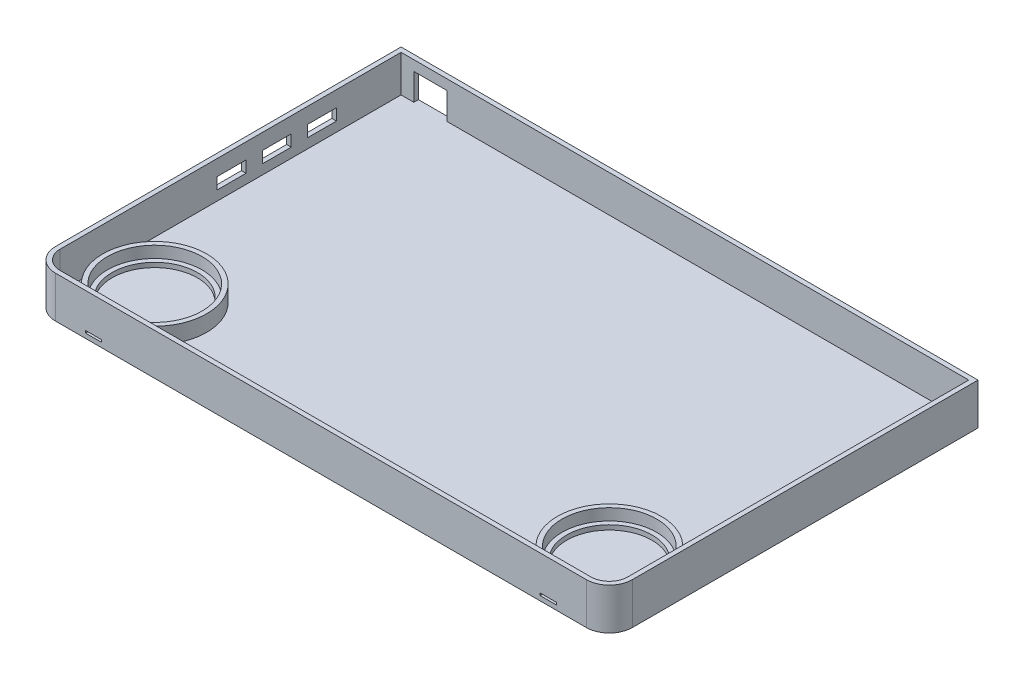
from build123d import *

# Parameters (mm, degrees)
EXTRUDE_2_DEPTH     = 18
SHELL_3_T           = -2
SKETCH_2_W          = 14.4
SKETCH_2_H          = 11.6
CUT_EXTRUDE_1_DEPTH = 10
SKETCH_3_W          = 12.5
SKETCH_3_H          = 5
CUT_EXTRUDE_2_DEPTH = 10
SKETCH_4_R          = 22.5
EXTRUDE_5_DEPTH     = 7
SHELL_START         = 2
SHELL_4_OUTLINE_R   = 20.5
SHELL_4_DEPTH       = 7
SKETCH_6_W          = 9
SKETCH_6_H          = 6.786647167
CUT_EXTRUDE_4_DEPTH = 14
SKETCH_9_W          = 2
SKETCH_9_H          = 3.464226151
SKETCH_9_H_2        = 3.181171453
SKETCH_9_H_3        = 3.477296157
EXTRUDE_6_DEPTH     = 7
EXTRUDE_8_DEPTH     = 2
SKETCH_11_W         = 7
SKETCH_11_H         = 1
CUT_EXTRUDE_5_DEPTH = 2


# Read off the part's stored shape, not the designer's step: 抽壳4
with BuildPart() as part:
    # 草图1 → 凸台-拉伸2 (new body)
    with BuildSketch(Plane(origin=(0, 0, 0), x_dir=(1, 0, 0), z_dir=(0, 1, 0))):
        with BuildLine():
            Line((-99.99792574, 53.871425224), (150.00207426, 53.871425224))
            Line((150.00207426, 53.871425224), (150.00207426, -95.878574776))
            ThreePointArc((150.00207426, -95.878574776), (147.073142072, -102.949642588), (140.00207426, -105.878574776))
            Line((140.00207426, -105.878574776), (-89.99792574, -105.878574776))
            ThreePointArc((-89.99792574, -105.878574776), (-97.068993552, -102.949642588), (-99.99792574, -95.878574776))
            Line((-99.99792574, -95.878574776), (-99.99792574, 53.871425224))
        make_face()
    extrude(amount=EXTRUDE_2_DEPTH)

    # 抽壳3
    shell_3_openings = [part.faces().sort_by_distance(p)[0] for p in [
        (25.00207426, 18, 25.920044782),
    ]]
    offset(amount=SHELL_3_T, openings=shell_3_openings, kind=Kind.INTERSECTION)

    # 草图2 → 切除-拉伸1 (cut)
    with BuildSketch(Plane.XY.offset(-51.871425224)):
        with Locations((-85.29792574, 7.8)):
            Rectangle(SKETCH_2_W, SKETCH_2_H)
    extrude(amount=-CUT_EXTRUDE_1_DEPTH, mode=Mode.SUBTRACT)

    # 草图3 → 切除-拉伸2 (cut)
    with BuildSketch(Plane(origin=(-97.99792574, 0, 0), x_dir=(0, 0, -1), z_dir=(1, 0, 0))):
        with Locations((17.621425224, 8.7)):
            Rectangle(SKETCH_3_W, SKETCH_3_H)
        with Locations((-1.978574776, 8.7)):
            Rectangle(SKETCH_3_W, SKETCH_3_H)
        with Locations((-21.578574776, 8.7)):
            Rectangle(SKETCH_3_W, SKETCH_3_H)
    extrude(amount=-CUT_EXTRUDE_2_DEPTH, mode=Mode.SUBTRACT)

    # 草图4 → 凸台-拉伸5 (add)
    with BuildSketch(Plane(origin=(0, 2, 0), x_dir=(1, 0, 0), z_dir=(0, 1, 0))):
        with Locations(Location((-73.49792574, -79.378574776, 0), (0, 0, 90))):
            Circle(SKETCH_4_R)
        with Locations(Location((123.50207426, -79.378574776, 0), (0, 0, 90))):
            Circle(SKETCH_4_R)
    extrude(amount=EXTRUDE_5_DEPTH)

    # 抽壳4 outline → 抽壳4 (cut)
    with BuildSketch(Plane(origin=(0, 0, 0), x_dir=(1, 0, 0), z_dir=(0, 1, 0)).offset(SHELL_START)):
        with Locations((123.50207426, -79.378574776)):
            Circle(SHELL_4_OUTLINE_R)
        with Locations((-73.49792574, -79.378574776)):
            Circle(SHELL_4_OUTLINE_R)
    extrude(amount=SHELL_4_DEPTH, mode=Mode.SUBTRACT)

    # 草图6 → 切除-拉伸4 (cut)
    with BuildSketch(Plane(origin=(0, 2, 0), x_dir=(1, 0, 0), z_dir=(0, 1, 0))):
        with Locations((-73.49792574, -100.485251193)):
            Rectangle(SKETCH_6_W, SKETCH_6_H)
        with Locations((123.50207426, -100.485251193)):
            Rectangle(SKETCH_6_W, SKETCH_6_H)
    extrude(amount=CUT_EXTRUDE_4_DEPTH, mode=Mode.SUBTRACT)

    # 草图9 → 凸台-拉伸6 (add)
    with BuildSketch(Plane(origin=(0, 2, 0), x_dir=(1, 0, 0), z_dir=(0, 1, 0))):
        with Locations((-78.99792574, -102.1464617)):
            Rectangle(SKETCH_9_W, SKETCH_9_H)
        with Locations((-67.99792574, -102.287989049)):
            Rectangle(SKETCH_9_W, SKETCH_9_H_2)
        with Locations((129.00207426, -102.287989049)):
            Rectangle(SKETCH_9_W, SKETCH_9_H_2)
        with Locations((118.00207426, -102.139926698)):
            Rectangle(SKETCH_9_W, SKETCH_9_H_3)
    extrude(amount=EXTRUDE_6_DEPTH)

    # 草图10 → 凸台-拉伸8 (add)
    with BuildSketch(Plane(origin=(0, 2, 0), x_dir=(1, 0, 0), z_dir=(0, 1, 0))):
        with BuildLine():
            Line((-77.99792574, -99.378574776), (-77.99792574, -97.322933221))
            ThreePointArc((-77.99792574, -97.322933221), (-73.49792574, -60.878574776), (-68.99792574, -97.322933221))
            Line((-68.99792574, -97.322933221), (-68.99792574, -99.378574776))
            ThreePointArc((-68.99792574, -99.378574776), (-73.49792574, -58.878574776), (-77.99792574, -99.378574776))
        make_face()
        with BuildLine():
            Line((119.00207426, -97.322933221), (119.00207426, -99.378574776))
            ThreePointArc((119.00207426, -99.378574776), (123.50207426, -58.878574776), (128.00207426, -99.378574776))
            Line((128.00207426, -99.378574776), (128.00207426, -97.322933221))
            ThreePointArc((128.00207426, -97.322933221), (123.50207426, -60.878574776), (119.00207426, -97.322933221))
        make_face()
    extrude(amount=EXTRUDE_8_DEPTH)

    # 草图11 → 切除-拉伸5 (cut)
    with BuildSketch(Plane(origin=(0, 0, 103.878574776), x_dir=(-1, 0, 0), z_dir=(0, 0, -1))):
        with Locations((73.49792574, 2.5)):
            Rectangle(SKETCH_11_W, SKETCH_11_H)
        with Locations((-123.50207426, 2.5)):
            Rectangle(SKETCH_11_W, SKETCH_11_H)
    extrude(amount=-CUT_EXTRUDE_5_DEPTH, mode=Mode.SUBTRACT)


solid = part.part
